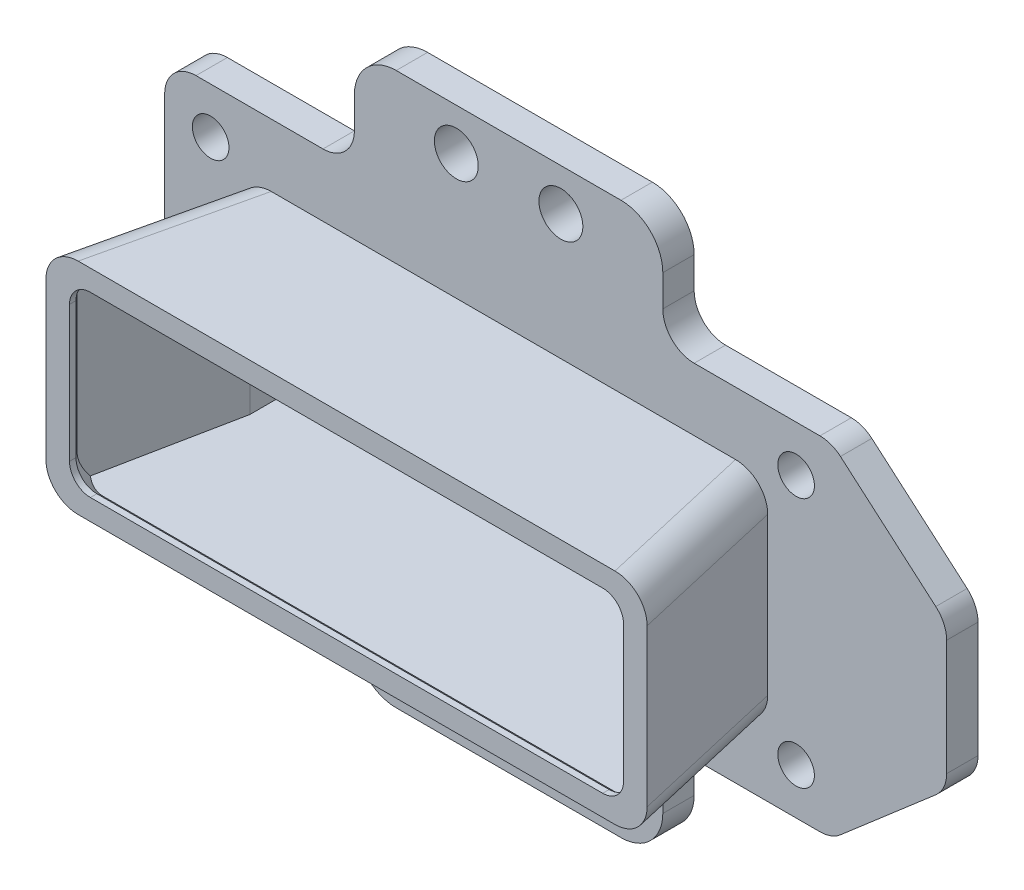
from build123d import *

# Parameters (mm, degrees)
SKETCH1_W           = 74.8
SKETCH1_H           = 32.8
BOSS_EXTRUDE1_DEPTH = 3
CUT_EXTRUDE1_DEPTH  = 3
SKETCH3_R           = 1.75
CUT_EXTRUDE2_DEPTH  = 3
SKETCH4_W           = 48.5
SKETCH4_H           = 18
CUT_EXTRUDE3_DEPTH  = 3
SKETCH5_W           = 57.5
SKETCH5_H           = 21
SKETCH5_W_2         = 48.5
SKETCH5_H_2         = 18
BOSS_EXTRUDE3_DEPTH = 15
CUT_EXTRUDE11_START = -10.6
CUT_EXTRUDE11_DEPTH = 21
CHAMFER1_SIZE       = 15
CHAMFER1_SIZE2      = 3
CHAMFER2_SIZE       = 3
CHAMFER2_SIZE2      = 15
SKETCH18_W          = 54.5
SKETCH18_H          = 18
SKETCH18_W_2        = 53
SKETCH18_H_2        = 17
BOSS_EXTRUDE6_DEPTH = 3
SKETCH12_W          = 29.5
SKETCH12_H          = 10
BOSS_EXTRUDE5_DEPTH = 3
SKETCH13_R          = 2.1
CUT_EXTRUDE9_DEPTH  = 3
FILLET2_R           = 3
FILLET3_R           = 3
FILLET4_R           = 4
FILLET5_R           = 3
FILLET11_R          = 2
CHAMFER11_SIZE      = 2.383507185
CHAMFER11_SIZE_2    = 2
CUT_EXTRUDE12_DEPTH = 2
CUT_EXTRUDE13_DEPTH = 2
SKETCH21_R          = 4
CUT_EXTRUDE14_DEPTH = 2


# Read off the part's stored shape, not the designer's step: Cut-Extrude11
with BuildPart() as part:
    # Sketch1 → Boss-Extrude1 (new body)
    with BuildSketch(Plane.XY):
        Rectangle(SKETCH1_W, SKETCH1_H)
    extrude(amount=BOSS_EXTRUDE1_DEPTH)

    # Sketch2 → Cut-Extrude1 (cut)
    with BuildSketch(Plane.XY.offset(3)):
        Polygon((37.4, 16.4), (26.4, 16.4), (37.4, 6.9), align=None)
        Polygon((37.4, -16.4), (37.4, -6.9), (26.4, -16.4), align=None)
    extrude(amount=-CUT_EXTRUDE1_DEPTH, mode=Mode.SUBTRACT)

    # Sketch3 → Cut-Extrude2 (cut)
    with BuildSketch(Plane.XY.offset(3)):
        with Locations((-33, 12)):
            Circle(SKETCH3_R)
        with Locations((-33, -12)):
            Circle(SKETCH3_R)
        with Locations((23, -12)):
            Circle(SKETCH3_R)
        with Locations((23, 12)):
            Circle(SKETCH3_R)
    extrude(amount=-CUT_EXTRUDE2_DEPTH, mode=Mode.SUBTRACT)

    # Sketch4 → Cut-Extrude3 (cut)
    with BuildSketch(Plane.XY.offset(3)):
        with Locations((-5, -0.1)):
            Rectangle(SKETCH4_W, SKETCH4_H)
    extrude(amount=-CUT_EXTRUDE3_DEPTH, mode=Mode.SUBTRACT)

    # Sketch5 → Boss-Extrude3 (add)
    with BuildSketch(Plane.XY.offset(3)):
        with Locations((-5, -0.1)):
            Rectangle(SKETCH5_W, SKETCH5_H)
        with Locations((-5, -0.1)):
            Rectangle(SKETCH5_W_2, SKETCH5_H_2, mode=Mode.SUBTRACT)
    extrude(amount=BOSS_EXTRUDE3_DEPTH)

    # Cut-Extrude11 outline → Cut-Extrude11 (cut)
    with BuildSketch(Plane(origin=(0, 0, 0), x_dir=(1, 0, 0), z_dir=(0, 1, 0)).offset(CUT_EXTRUDE11_START)):
        Polygon((-33.75, -3), (-33.75, -18), (-30.286977133, -3), align=None)
        Polygon((23.75, -3), (20.286977133, -3), (23.75, -18), align=None)
    extrude(amount=CUT_EXTRUDE11_DEPTH, mode=Mode.SUBTRACT)

    # Chamfer1
    chamfer1_edges = [part.edges().sort_by_distance(p)[0] for p in [
        (19.25, -0.1, 18),
    ]]
    chamfer1_side = [part.faces().sort_by_distance(p)[0] for p in [
        (19.25, -0.1, 9),
    ]]
    chamfer(chamfer1_edges, length=CHAMFER1_SIZE, length2=CHAMFER1_SIZE2, reference=chamfer1_side[0])

    # Chamfer2
    chamfer2_edges = [part.edges().sort_by_distance(p)[0] for p in [
        (-29.25, -0.1, 18),
    ]]
    chamfer2_side = [part.faces().sort_by_distance(p)[0] for p in [
        (-3.5, 9.512147858, 18),
    ]]
    chamfer(chamfer2_edges, length=CHAMFER2_SIZE, length2=CHAMFER2_SIZE2, reference=chamfer2_side[0])

    # Sketch18 → Boss-Extrude6 (add)
    with BuildSketch(Plane.XY.offset(18)):
        with Locations((-5, -0.1)):
            Rectangle(SKETCH18_W, SKETCH18_H)
        with Locations((-5, -0.1)):
            Rectangle(SKETCH18_W_2, SKETCH18_H_2, mode=Mode.SUBTRACT)
    extrude(amount=-BOSS_EXTRUDE6_DEPTH)

    # Sketch12 → Boss-Extrude5 (add)
    with BuildSketch(Plane(origin=(0, 0, 0), x_dir=(-1, 0, 0), z_dir=(0, 0, -1))):
        with Locations((4.5, 21.4)):
            Rectangle(SKETCH12_W, SKETCH12_H)
        with Locations((4.5, -21.4)):
            Rectangle(SKETCH12_W, SKETCH12_H)
    extrude(amount=-BOSS_EXTRUDE5_DEPTH)

    # Sketch13 → Cut-Extrude9 (cut)
    with BuildSketch(Plane(origin=(0, 0, 0), x_dir=(-1, 0, 0), z_dir=(0, 0, -1))):
        with Locations((-0.5, 22.4)):
            Circle(SKETCH13_R)
        with Locations((9.5, 22.4)):
            Circle(SKETCH13_R)
        with Locations((-0.5, -22.4)):
            Circle(SKETCH13_R)
        with Locations((9.5, -22.4)):
            Circle(SKETCH13_R)
    extrude(amount=-CUT_EXTRUDE9_DEPTH, mode=Mode.SUBTRACT)

    # Fillet2
    fillet2_edges = [part.edges().sort_by_distance(p)[0] for p in [
        (22.018488567, 10.4, 10.5),
        (22.018488567, -10.6, 10.5),
        (-32.018488566, -10.6, 10.5),
        (-32.018488566, 10.4, 10.5),
    ]]
    fillet(fillet2_edges, radius=FILLET2_R)

    # Fillet3
    fillet3_edges = [part.edges().sort_by_distance(p)[0] for p in [
        (37.4, 6.9, 1.5),
        (26.4, 16.4, 1.5),
        (26.4, -16.4, 1.5),
        (37.4, -6.9, 1.5),
        (-37.4, -16.4, 1.5),
        (-37.4, 16.4, 1.5),
    ]]
    fillet(fillet3_edges, radius=FILLET3_R)

    # Fillet4
    fillet4_edges = [part.edges().sort_by_distance(p)[0] for p in [
        (-19.25, 26.4, 1.5),
        (10.25, 26.4, 1.5),
        (10.25, -26.4, 1.5),
        (-19.25, -26.4, 1.5),
    ]]
    fillet(fillet4_edges, radius=FILLET4_R)

    # Fillet5
    fillet5_edges = [part.edges().sort_by_distance(p)[0] for p in [
        (-19.25, 16.4, 1.5),
        (10.25, 16.4, 1.5),
        (10.25, -16.4, 1.5),
        (-19.25, -16.4, 1.5),
    ]]
    fillet(fillet5_edges, radius=FILLET5_R)

    # Fillet11
    fillet11_edges = [part.edges().sort_by_distance(p)[0] for p in [
        (21.5, 8.4, 16.5),
        (-31.5, 8.4, 16.5),
        (-31.5, -8.6, 16.5),
        (21.5, -8.6, 16.5),
    ]]
    fillet(fillet11_edges, radius=FILLET11_R)

    # Chamfer11
    # the kernel refuses this chamfer: 2.383507185, 2 mm, written as the material it takes off along each edge
    with BuildSketch(Plane(origin=(-31.5, -6.6, 15), x_dir=(0.024939322090233706, 0, 0.9996889667359941), z_dir=(0, 1, 0))) as chamfer11_piece_1_section:
        Polygon((CHAMFER11_SIZE * 0.999688966815, -CHAMFER11_SIZE * 0.0249393220922), (-CHAMFER11_SIZE_2 * 0.0249393220902, -CHAMFER11_SIZE_2 * 0.999688966736), (0, 0), align=None)
    chamfer11_piece_1 = extrude(amount=13, mode=Mode.PRIVATE)
    chamfer11_piece_1 = split(chamfer11_piece_1, bisect_by=Plane(origin=(-31.892473609, -0.1, 16.212368046), z_dir=(0.9805806756909202, 0, 0.196116135138184)), keep=Keep.TOP, mode=Mode.PRIVATE)
    add(chamfer11_piece_1, mode=Mode.SUBTRACT)
    with BuildSketch(Plane(origin=(19.5, -8.6, 15), x_dir=(0, 0.024939322090234427, 0.9996889667359941), z_dir=(-1, 0, 0))) as chamfer11_piece_2_section:
        Polygon((CHAMFER11_SIZE * 0.999688966815, -CHAMFER11_SIZE * 0.0249393220922), (-CHAMFER11_SIZE_2 * 0.0249393220902, -CHAMFER11_SIZE_2 * 0.999688966736), (0, 0), align=None)
    chamfer11_piece_2 = extrude(amount=49, mode=Mode.PRIVATE)
    chamfer11_piece_2 = split(chamfer11_piece_2, bisect_by=Plane(origin=(-5, -9.1, 16.074399324), z_dir=(0, 1, 0)), keep=Keep.TOP, mode=Mode.PRIVATE)
    add(chamfer11_piece_2, mode=Mode.SUBTRACT)
    with BuildSketch(Plane(origin=(-29.5, 8.4, 15), x_dir=(0, -0.024939322090234427, 0.9996889667359941), z_dir=(1, 0, 0))) as chamfer11_piece_3_section:
        Polygon((CHAMFER11_SIZE * 0.999688966815, -CHAMFER11_SIZE * 0.0249393220922), (-CHAMFER11_SIZE_2 * 0.0249393220902, -CHAMFER11_SIZE_2 * 0.999688966736), (0, 0), align=None)
    chamfer11_piece_3 = extrude(amount=49, mode=Mode.PRIVATE)
    chamfer11_piece_3 = split(chamfer11_piece_3, bisect_by=Plane(origin=(-5, 8.9, 16.074399324), z_dir=(0, -1, 0)), keep=Keep.TOP, mode=Mode.PRIVATE)
    add(chamfer11_piece_3, mode=Mode.SUBTRACT)
    with BuildSketch(Plane(origin=(21.5, 6.4, 15), x_dir=(-0.024939322090233706, 0, 0.9996889667359941), z_dir=(0, -1, 0))) as chamfer11_piece_4_section:
        Polygon((CHAMFER11_SIZE * 0.999688966815, -CHAMFER11_SIZE * 0.0249393220922), (-CHAMFER11_SIZE_2 * 0.0249393220902, -CHAMFER11_SIZE_2 * 0.999688966736), (0, 0), align=None)
    chamfer11_piece_4 = extrude(amount=13, mode=Mode.PRIVATE)
    chamfer11_piece_4 = split(chamfer11_piece_4, bisect_by=Plane(origin=(21.892473609, -0.1, 16.212368046), z_dir=(-0.9805806756909202, 0, 0.19611613513818402)), keep=Keep.TOP, mode=Mode.PRIVATE)
    add(chamfer11_piece_4, mode=Mode.SUBTRACT)
    with BuildSketch(Plane(origin=(-29.5, -6.6, 15), x_dir=(-1, 0, 0), z_dir=(0, 1, 0))) as chamfer11_piece_5_section:
        Polygon((2, CHAMFER11_SIZE), (2 + CHAMFER11_SIZE_2, 0), (2, 0), align=None)
    chamfer11_piece_5 = revolve(axis=Axis((-29.5, -6.6, 15), (0, 0, 1)), revolution_arc=90, mode=Mode.PRIVATE)
    chamfer11_piece_5 = split(chamfer11_piece_5, bisect_by=Plane(origin=(-31.818510416, -8.221304707, 15.842552081), z_dir=(0.9805806756909202, 0, 0.196116135138184)), keep=Keep.TOP, mode=Mode.PRIVATE)
    chamfer11_piece_5 = split(chamfer11_piece_5, bisect_by=Plane(origin=(-30.957610473, -9.1, 16.014732069), z_dir=(0, 1, 0)), keep=Keep.TOP, mode=Mode.PRIVATE)
    add(chamfer11_piece_5, mode=Mode.SUBTRACT)
    with BuildSketch(Plane(origin=(19.5, -6.6, 15), x_dir=(0, -1, 0), z_dir=(-1, 0, 0))) as chamfer11_piece_6_section:
        Polygon((2, CHAMFER11_SIZE), (2 + CHAMFER11_SIZE_2, 0), (2, 0), align=None)
    chamfer11_piece_6 = revolve(axis=Axis((19.5, -6.6, 15), (0, 0, 1)), revolution_arc=90, mode=Mode.PRIVATE)
    chamfer11_piece_6 = split(chamfer11_piece_6, bisect_by=Plane(origin=(21.818510413, -8.221304708, 15.842552067), z_dir=(-0.9805806756909202, 0, 0.19611613513818402)), keep=Keep.TOP, mode=Mode.PRIVATE)
    chamfer11_piece_6 = split(chamfer11_piece_6, bisect_by=Plane(origin=(20.957610477, -9.1, 16.014732055), z_dir=(0, 1, 0)), keep=Keep.TOP, mode=Mode.PRIVATE)
    add(chamfer11_piece_6, mode=Mode.SUBTRACT)
    with BuildSketch(Plane(origin=(-29.5, 6.4, 15), x_dir=(0, 1, 0), z_dir=(1, 0, 0))) as chamfer11_piece_7_section:
        Polygon((2, CHAMFER11_SIZE), (2 + CHAMFER11_SIZE_2, 0), (2, 0), align=None)
    chamfer11_piece_7 = revolve(axis=Axis((-29.5, 6.4, 15), (0, 0, 1)), revolution_arc=90, mode=Mode.PRIVATE)
    chamfer11_piece_7 = split(chamfer11_piece_7, bisect_by=Plane(origin=(-30.957610477, 8.9, 16.014732055), z_dir=(0, -1, 0)), keep=Keep.TOP, mode=Mode.PRIVATE)
    chamfer11_piece_7 = split(chamfer11_piece_7, bisect_by=Plane(origin=(-31.818510413, 8.021304708, 15.842552067), z_dir=(0.9805806756909202, 0, 0.196116135138184)), keep=Keep.TOP, mode=Mode.PRIVATE)
    add(chamfer11_piece_7, mode=Mode.SUBTRACT)
    with BuildSketch(Plane(origin=(19.5, 6.4, 15), x_dir=(0, 1, 0), z_dir=(-1, 0, 0))) as chamfer11_piece_8_section:
        Polygon((2, -CHAMFER11_SIZE), (2 + CHAMFER11_SIZE_2, 0), (2, 0), align=None)
    chamfer11_piece_8 = revolve(axis=Axis((19.5, 6.4, 15), (0, 0, -1)), revolution_arc=90, mode=Mode.PRIVATE)
    chamfer11_piece_8 = split(chamfer11_piece_8, bisect_by=Plane(origin=(21.818510414, 8.021304708, 15.842552069), z_dir=(-0.9805806756909202, 0, 0.19611613513818402)), keep=Keep.TOP, mode=Mode.PRIVATE)
    chamfer11_piece_8 = split(chamfer11_piece_8, bisect_by=Plane(origin=(20.957610476, 8.9, 16.014732056), z_dir=(0, -1, 0)), keep=Keep.TOP, mode=Mode.PRIVATE)
    add(chamfer11_piece_8, mode=Mode.SUBTRACT)

    # Sketch19 → Cut-Extrude12 (cut)
    with BuildSketch(Plane(origin=(0, 0, 0), x_dir=(-1, 0, 0), z_dir=(0, 0, -1))):
        with BuildLine():
            Line((0, 14.4), (10, 14.4))
            ThreePointArc((10, 14.4), (11.25, 13.15), (10, 11.9))
            Line((10, 11.9), (0, 11.9))
            ThreePointArc((0, 11.9), (-1.25, 13.15), (0, 14.4))
        make_face()
    extrude(amount=-CUT_EXTRUDE12_DEPTH, mode=Mode.SUBTRACT)

    # Sketch20 → Cut-Extrude13 (cut)
    with BuildSketch(Plane(origin=(0, 0, 0), x_dir=(-1, 0, 0), z_dir=(0, 0, -1))):
        with BuildLine():
            Line((35.9, -1.15), (35.9, -7.15))
            ThreePointArc((35.9, -7.15), (34.65, -8.4), (33.4, -7.15))
            Line((33.4, -7.15), (33.4, -1.15))
            ThreePointArc((33.4, -1.15), (34.65, 0.1), (35.9, -1.15))
        make_face()
    extrude(amount=-CUT_EXTRUDE13_DEPTH, mode=Mode.SUBTRACT)

    # Sketch21 → Cut-Extrude14 (cut)
    with BuildSketch(Plane(origin=(0, 0, 0), x_dir=(-1, 0, 0), z_dir=(0, 0, -1))):
        with Locations((-28.5, 0)):
            Circle(SKETCH21_R)
    extrude(amount=-CUT_EXTRUDE14_DEPTH, mode=Mode.SUBTRACT)


solid = part.part
